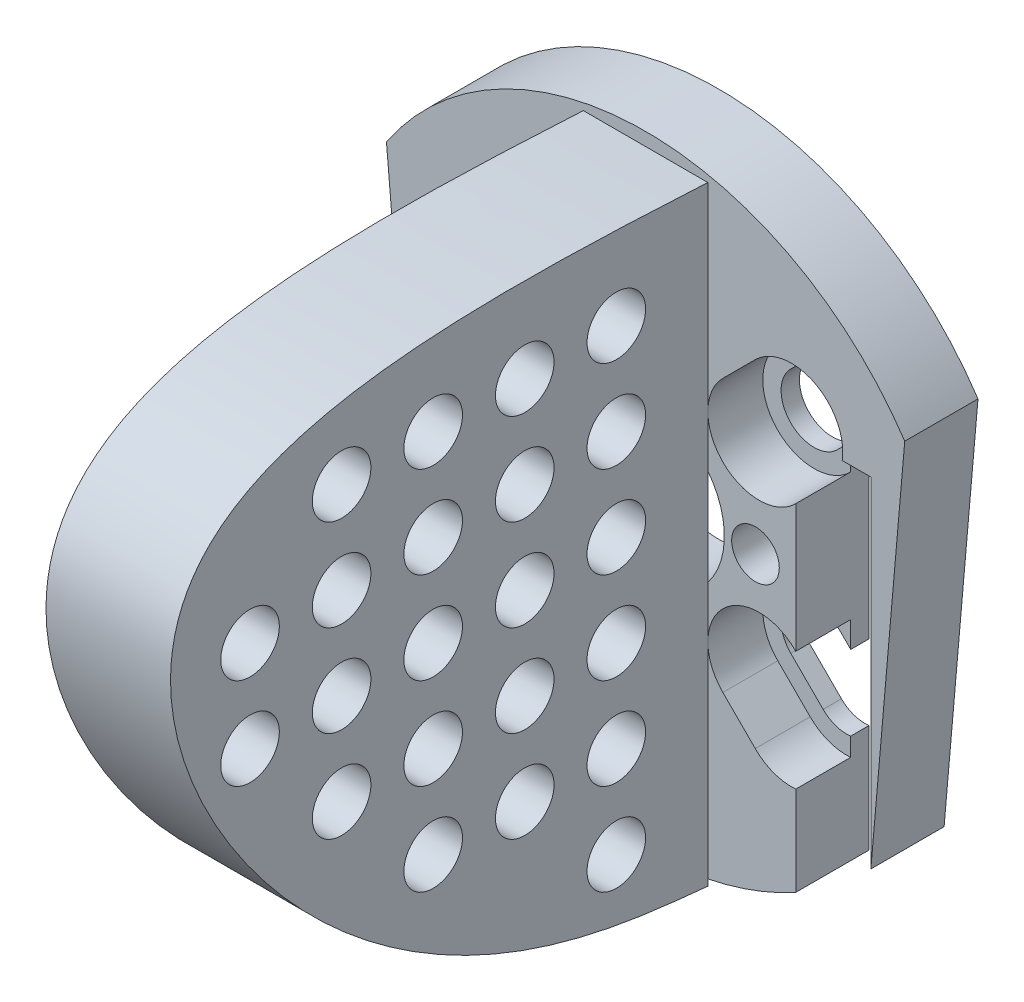
from build123d import *

# Parameters (mm, degrees)
SKETCH_2_R          = 1.3
SKETCH_2_R_2        = 4.3
EXTRUDE_1_DEPTH     = 4
CUT_EXTRUDE_1_DEPTH = 3
EXTRUDE_START       = -3.4
EXTRUDE_2_DEPTH     = 6.8
CUT_EXTRUDE_START   = 3.4
SKETCH_12_R         = 1.6
CUT_EXTRUDE_2_DEPTH = 44.412015776


# Read off the part's stored shape, not the designer's step: 凸台-拉伸2
with BuildPart() as part:
    # 草图2 → 凸台-拉伸1 (new body)
    with BuildSketch(Plane.XY):
        with BuildLine():
            Line((-14.150895062, 9.420836955), (-12.3, -11.734990413))
            Line((-12.3, -11.734990413), (-12.3, 6.8))
            Line((-12.3, 6.8), (-9.717210306, 6.8))
            ThreePointArc((-9.717210306, 6.8), (-8.843521096, 8.787489117), (-6.693130483, 8.488714895))
            Line((-6.693130483, 8.488714895), (-4.92536353, 6.720947942))
            ThreePointArc((-4.92536353, 6.720947942), (-4.92536353, 4.17536353), (-7.470947942, 4.17536353))
            Line((-7.470947942, 4.17536353), (-8.2, 4.904415588))
            Line((-8.2, 4.904415588), (-8.2, -4.904415588))
            Line((-8.2, -4.904415588), (-7.470947942, -4.17536353))
            ThreePointArc((-7.470947942, -4.17536353), (-4.92536353, -4.17536353), (-4.92536353, -6.720947942))
            Line((-4.92536353, -6.720947942), (-6.693130483, -8.488714895))
            ThreePointArc((-6.693130483, -8.488714895), (-7.386916292, -8.92025587), (-8.2, -9.00063774))
            Line((-8.2, -9.00063774), (-8.2, -14.891608375))
            ThreePointArc((-8.2, -14.891608375), (0, -17), (8.2, -14.891608375))
            Line((8.2, -14.891608375), (8.2, -9.00063774))
            ThreePointArc((8.2, -9.00063774), (7.386916292, -8.92025587), (6.693130483, -8.488714895))
            Line((6.693130483, -8.488714895), (4.92536353, -6.720947942))
            ThreePointArc((4.92536353, -6.720947942), (4.92536353, -4.17536353), (7.470947942, -4.17536353))
            Line((7.470947942, -4.17536353), (8.2, -4.904415588))
            Line((8.2, -4.904415588), (8.2, 4.904415588))
            Line((8.2, 4.904415588), (7.470947942, 4.17536353))
            ThreePointArc((7.470947942, 4.17536353), (4.92536353, 4.17536353), (4.92536353, 6.720947942))
            Line((4.92536353, 6.720947942), (6.693130483, 8.488714895))
            ThreePointArc((6.693130483, 8.488714895), (8.843521096, 8.787489117), (9.717210306, 6.8))
            Line((9.717210306, 6.8), (12.3, 6.8))
            Line((12.3, 6.8), (12.3, -11.734990413))
            Line((12.3, -11.734990413), (14.150895062, 9.420836955))
            ThreePointArc((14.150895062, 9.420836955), (0, 17), (-14.150895062, 9.420836955))
        make_face()
        with Locations((-6, 0)):
            Circle(SKETCH_2_R, mode=Mode.SUBTRACT)
        Circle(SKETCH_2_R_2, mode=Mode.SUBTRACT)
        with Locations((6, 0)):
            Circle(SKETCH_2_R, mode=Mode.SUBTRACT)
    extrude(amount=EXTRUDE_1_DEPTH)

    # 草图10 → 切除-拉伸1 (cut)
    with BuildSketch(Plane.XY.offset(4)):
        with BuildLine():
            Line((-5.986023702, 9.195821676), (-4.218256749, 7.428054723))
            ThreePointArc((-4.218256749, 7.428054723), (-4.218256749, 3.468256749), (-8.178054723, 3.468256749))
            Line((-8.178054723, 3.468256749), (-9.945821676, 5.236023702))
            ThreePointArc((-9.945821676, 5.236023702), (-9.945821676, 9.195821676), (-5.986023702, 9.195821676))
        make_face()
        with BuildLine():
            Line((-5.986023702, -9.195821676), (-4.218256749, -7.428054723))
            ThreePointArc((-4.218256749, -7.428054723), (-4.218256749, -3.468256749), (-8.178054723, -3.468256749))
            Line((-8.178054723, -3.468256749), (-9.945821676, -5.236023702))
            ThreePointArc((-9.945821676, -5.236023702), (-9.945821676, -9.195821676), (-5.986023702, -9.195821676))
        make_face()
        with BuildLine():
            Line((5.986023702, 9.195821676), (4.218256749, 7.428054723))
            ThreePointArc((4.218256749, 7.428054723), (4.218256749, 3.468256749), (8.178054723, 3.468256749))
            Line((8.178054723, 3.468256749), (9.945821676, 5.236023702))
            ThreePointArc((9.945821676, 5.236023702), (9.945821676, 9.195821676), (5.986023702, 9.195821676))
        make_face()
        with BuildLine():
            Line((5.986023702, -9.195821676), (4.218256749, -7.428054723))
            ThreePointArc((4.218256749, -7.428054723), (4.218256749, -3.468256749), (8.178054723, -3.468256749))
            Line((8.178054723, -3.468256749), (9.945821676, -5.236023702))
            ThreePointArc((9.945821676, -5.236023702), (9.945821676, -9.195821676), (5.986023702, -9.195821676))
        make_face()
    extrude(amount=-CUT_EXTRUDE_1_DEPTH, mode=Mode.SUBTRACT)

    # 凸台-拉伸2 outline → 凸台-拉伸2 (add)
    with BuildSketch(Plane(origin=(0, 0, 0), x_dir=(0, 0, -1), z_dir=(1, 0, 0)).offset(EXTRUDE_START)):
        with BuildLine():
            Line((-4, -17), (-4, 16.2788168))
            add(Edge.make_bspline(
                [(-4, 16.2788168), (-25.43589952, 17.477300344), (-46.149481519, 17.5570925), (-34, 4.437094901), (-30.42433351, -15.568255951), (-11.367420307, -16.201944254), (-4, -17)],
                knots=[0, 0, 0, 0, 0, 0, 0, 1, 1, 1, 1, 1, 1, 1], degree=6))
        make_face()
    extrude(amount=EXTRUDE_2_DEPTH)

    # 草图12 → 切除-拉伸2 (cut, through all)
    with BuildSketch(Plane(origin=(0, 0, 0), x_dir=(0, 0, -1), z_dir=(1, 0, 0)).offset(CUT_EXTRUDE_START)):
        with Locations((-9, 12)):
            Circle(SKETCH_12_R)
        with Locations((-9, -13)):
            Circle(SKETCH_12_R)
        with Locations((-9, 7)):
            Circle(SKETCH_12_R)
        with Locations((-9, -8)):
            Circle(SKETCH_12_R)
        with Locations((-9, 2)):
            Circle(SKETCH_12_R)
        with Locations((-9, -3)):
            Circle(SKETCH_12_R)
        with Locations((-29, 7)):
            Circle(SKETCH_12_R)
        with Locations((-29, 2)):
            Circle(SKETCH_12_R)
        with Locations((-24, 12)):
            Circle(SKETCH_12_R)
        with Locations((-19, 12)):
            Circle(SKETCH_12_R)
        with Locations((-14, 12)):
            Circle(SKETCH_12_R)
        with Locations((-24, 7)):
            Circle(SKETCH_12_R)
        with Locations((-19, 7)):
            Circle(SKETCH_12_R)
        with Locations((-14, 7)):
            Circle(SKETCH_12_R)
        with Locations((-24, 2)):
            Circle(SKETCH_12_R)
        with Locations((-19, 2)):
            Circle(SKETCH_12_R)
        with Locations((-14, 2)):
            Circle(SKETCH_12_R)
        with Locations((-24, -3)):
            Circle(SKETCH_12_R)
        with Locations((-19, -3)):
            Circle(SKETCH_12_R)
        with Locations((-14, -3)):
            Circle(SKETCH_12_R)
        with Locations((-19, -8)):
            Circle(SKETCH_12_R)
        with Locations((-14, -8)):
            Circle(SKETCH_12_R)
    extrude(amount=-CUT_EXTRUDE_2_DEPTH, mode=Mode.SUBTRACT)


solid = part.part
